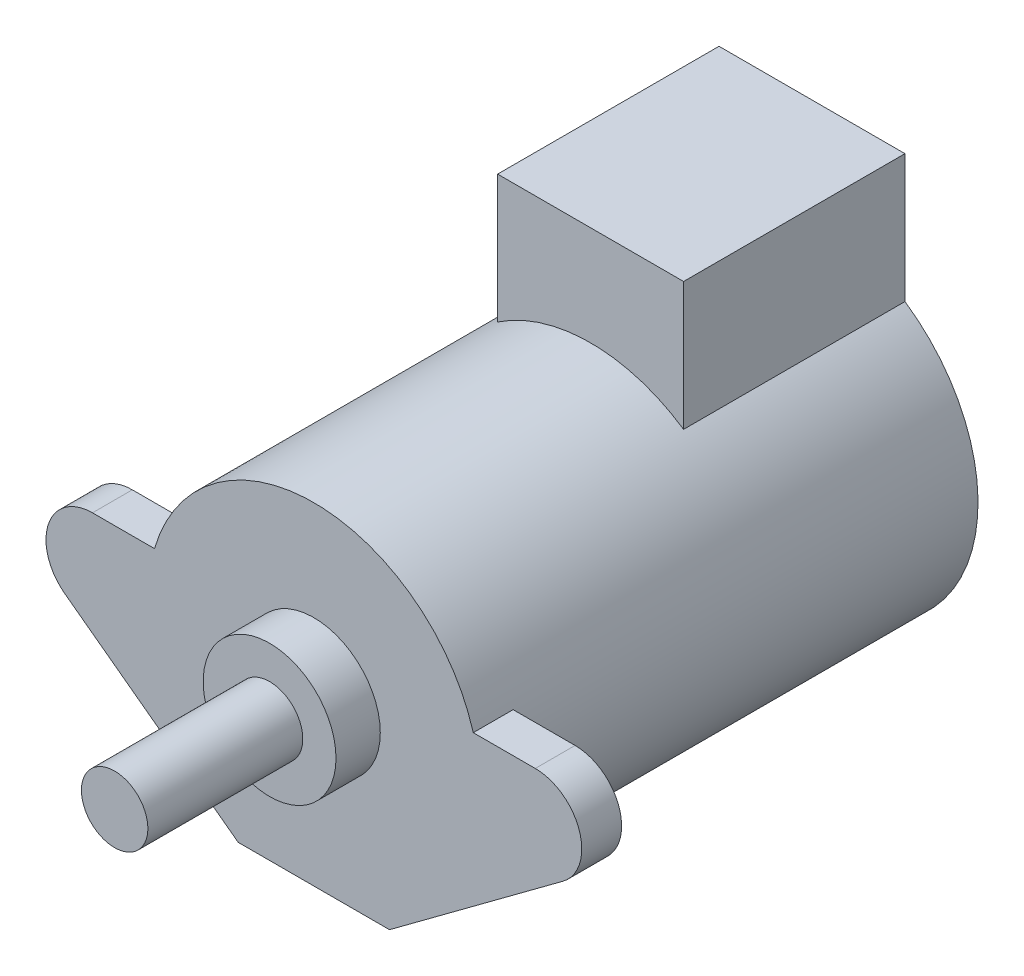
from build123d import *
from build123d.topology import SkipClean

# Parameters (mm, degrees)
BOSS_EXTRUDE1_DEPTH = 22.5
SKETCH2_R           = 3
BOSS_EXTRUDE2_DEPTH = 2
SKETCH3_OUTSIDE_W   = 33.712
SKETCH3_OUTSIDE_H   = 24.512
SKETCH3_OUTSIDE_R   = 7.5
CUT_EXTRUDE1_DEPTH  = 20.7
SKETCH4_R           = 1.5
BOSS_EXTRUDE3_DEPTH = 7
SKETCH5_W           = 8.4
SKETCH5_H           = 5.786305447
BOSS_EXTRUDE4_DEPTH = 10


with BuildPart() as part:
    # Sketch1 → Boss-Extrude1 (new body)
    with BuildSketch(Plane.XY):
        with BuildLine():
            Line((-11.251411697, -1.686407058), (-3.416992222, -7.5))
            Line((-3.416992222, -7.5), (3.416992222, -7.5))
            Line((3.416992222, -7.5), (11.251411697, -1.686407058))
            ThreePointArc((11.251411697, -1.686407058), (11.993922619, 0.658993619), (10, 2.1))
            Line((10, 2.1), (7.2, 2.1))
            ThreePointArc((7.2, 2.1), (0, 7.5), (-7.2, 2.1))
            Line((-7.2, 2.1), (-10, 2.1))
            ThreePointArc((-10, 2.1), (-11.993922619, 0.658993619), (-11.251411697, -1.686407058))
        make_face()
    extrude(amount=BOSS_EXTRUDE1_DEPTH)

    # Sketch2 → Boss-Extrude2 (add)
    with BuildSketch(Plane.XY.offset(22.5)):
        Circle(SKETCH2_R)
    extrude(amount=BOSS_EXTRUDE2_DEPTH)

    # Sketch3 outside → Cut-Extrude1 (cut)
    with SkipClean():  # the faces are left unmerged after this step: merging them gives an invalid solid
        with BuildSketch(Plane(origin=(0, 0, 0), x_dir=(-1, 0, 0), z_dir=(0, 0, -1))):
            Rectangle(SKETCH3_OUTSIDE_W, SKETCH3_OUTSIDE_H)
            with Locations(Location((0, 0, 0), (0, 0, 16.260204708))):
                Circle(SKETCH3_OUTSIDE_R, mode=Mode.SUBTRACT)
        extrude(amount=-CUT_EXTRUDE1_DEPTH, mode=Mode.SUBTRACT)
    add(part.part.scale(1), mode=Mode.REPLACE)  # the faces are merged on a copy

    # Sketch4 → Boss-Extrude3 (add)
    with BuildSketch(Plane.XY.offset(24.5)):
        with Locations(Location((0, 0, 0), (0, 0, 180))):
            Circle(SKETCH4_R)
    extrude(amount=BOSS_EXTRUDE3_DEPTH)

    # Sketch5 → Boss-Extrude4 (add)
    with BuildSketch(Plane(origin=(0, 0, 0), x_dir=(-1, 0, 0), z_dir=(0, 0, -1))):
        with Locations((0, 9.106847276)):
            Rectangle(SKETCH5_W, SKETCH5_H)
    extrude(amount=-BOSS_EXTRUDE4_DEPTH)


solid = part.part
